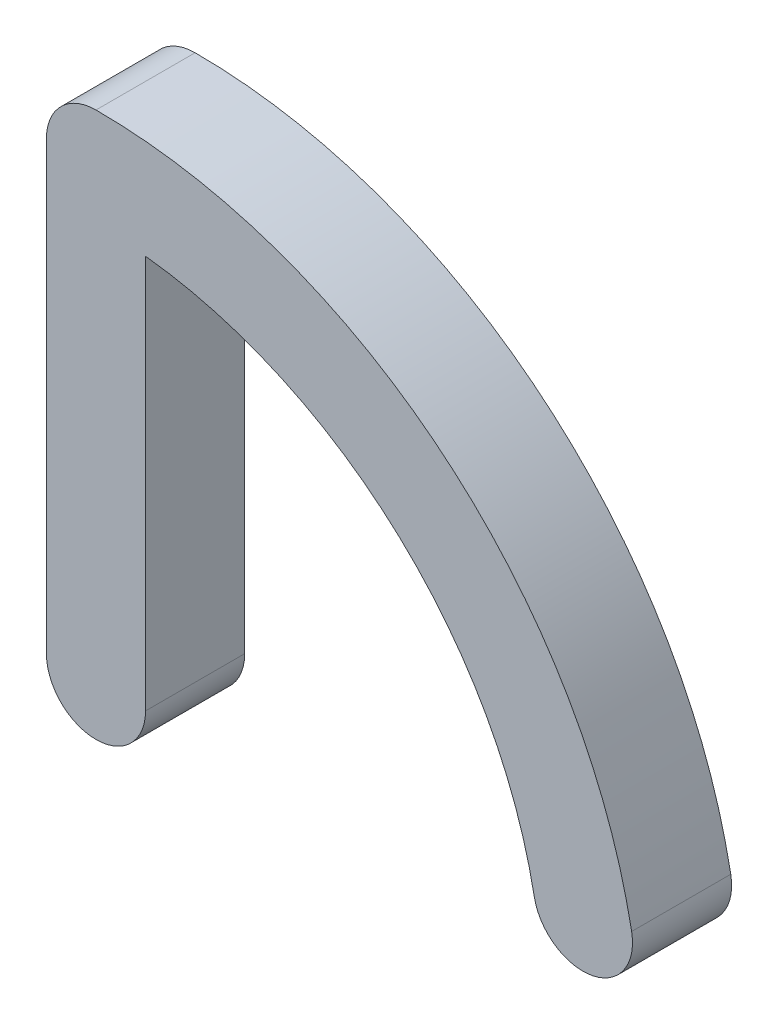
from build123d import *

# Parameters (mm, degrees)
EXTRUDE_THIN1_DEPTH = 10
FILLET1_R           = 5
FILLET2_R           = 5
FILLET3_R           = 5
FILLET4_R           = 5
FILLET5_R           = 5
CUT_EXTRUDE1_DEPTH  = 4.5


with BuildPart() as part:
    # Sketch1 → Extrude-Thin1 (new body)
    with BuildSketch(Plane.XY):
        with BuildLine():
            Line((5, 0), (5, 44.72135955))
            ThreePointArc((5, 44.72135955), (32.200514423, 31.434485377), (44.828761414, 3.922008424))
            Line((44.828761414, 3.922008424), (54.790708395, 4.793565851))
            ThreePointArc((54.790708395, 4.793565851), (35.273871656, 42.198980774), (-5, 54.772255751))
            Line((-5, 54.772255751), (-5, 0))
            Line((-5, 0), (5, 0))
        make_face()
    extrude(amount=EXTRUDE_THIN1_DEPTH)

    # Fillet1
    fillet1_edges = [part.edges().sort_by_distance(p)[0] for p in [
        (-5, 54.772255751, 5),
    ]]
    fillet(fillet1_edges, radius=FILLET1_R)

    # Fillet2
    fillet2_edges = [part.edges().sort_by_distance(p)[0] for p in [
        (54.790708395, 4.793565851, 5),
    ]]
    fillet(fillet2_edges, radius=FILLET2_R)

    # Fillet3
    fillet3_edges = [part.edges().sort_by_distance(p)[0] for p in [
        (44.828761414, 3.922008424, 5),
    ]]
    fillet(fillet3_edges, radius=FILLET3_R - 0.0001)  # a hair under: the kernel refuses the full size

    # Fillet4
    fillet4_edges = [part.edges().sort_by_distance(p)[0] for p in [
        (5, 0, 5),
    ]]
    fillet(fillet4_edges, radius=FILLET4_R)

    # Fillet5
    fillet5_edges = [part.edges().sort_by_distance(p)[0] for p in [
        (-5, 0, 5),
    ]]
    fillet(fillet5_edges, radius=FILLET5_R - 0.0001)  # a hair under: the kernel refuses the full size

    # Sketch2 → Cut-Extrude1 (cut)
    with BuildSketch(Plane(origin=(0, 0, 0), x_dir=(-1, 0, 0), z_dir=(0, 0, -1))):
        with BuildLine():
            Line((1.923996328, 19.347205988), (2.921, 7.13741415))
            ThreePointArc((2.921, 7.13741415), (0, 1.3805), (-2.921, 7.13741415))
            Line((-2.921, 7.13741415), (-1.923996328, 19.347205988))
            ThreePointArc((-1.923996328, 19.347205988), (0, 21.1205), (1.923996328, 19.347205988))
        make_face()
    extrude(amount=-CUT_EXTRUDE1_DEPTH, mode=Mode.SUBTRACT)


solid = part.part
